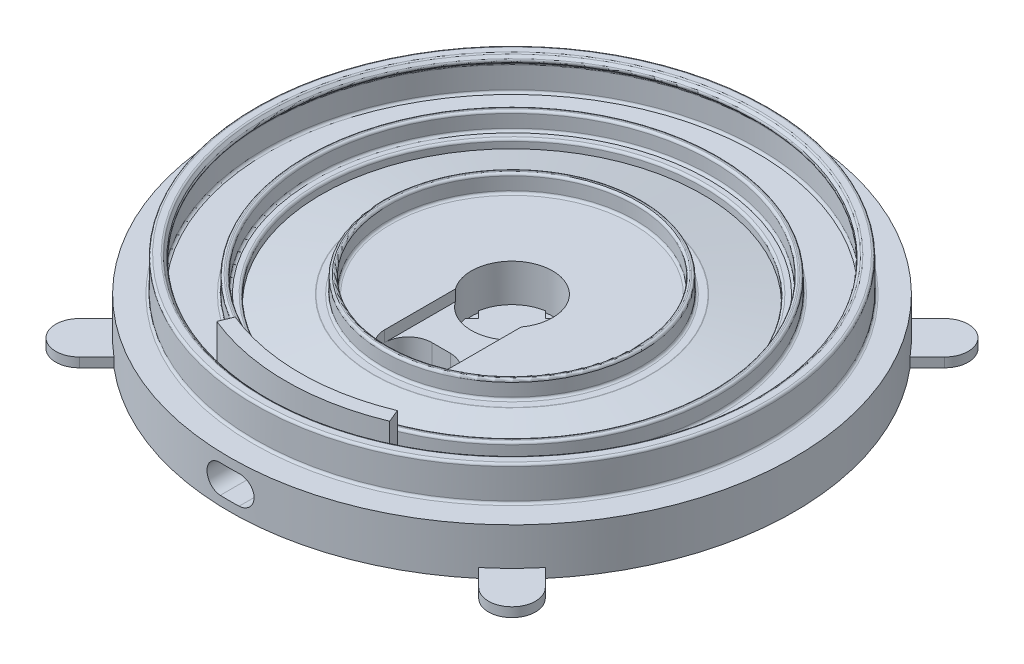
from build123d import *

# Parameters (mm, degrees)
SKETCH1_R               = 60
BOSS_EXTRUDE1_DEPTH     = 10
SKETCH3_R               = 43.75
SKETCH3_R_2             = 42.5
SKETCH3_R_3             = 27.5
SKETCH3_R_4             = 26.25
BOSS_EXTRUDE2_DEPTH     = 3.723
FILLET1_R               = 0.5
FILLET2_R               = 0.5
SKETCH6_R               = 8.625
CUT_EXTRUDE1_DEPTH      = 8.354
SKETCH9_W               = 14
SKETCH9_H               = 15
CUT_EXTRUDE2_DEPTH      = 2.354
CUT_EXTRUDE3_DEPTH      = 10
CUT_EXTRUDE4_DEPTH      = 2
CUT_EXTRUDE4_DEPTH_BACK = 40
BOSS_EXTRUDE3_DEPTH     = 2
BOSS_EXTRUDE4_DEPTH     = 8


with BuildPart() as part:
    # Sketch1 → Boss-Extrude1 (new body)
    with BuildSketch(Plane(origin=(0, 0, 0), x_dir=(1, 0, 0), z_dir=(0, 1, 0))):
        Circle(SKETCH1_R)
    extrude(amount=BOSS_EXTRUDE1_DEPTH)

    # Sketch2 → Cut-Revolve1 (revolve, cut)
    with BuildSketch(Plane.XY):
        Polygon((-29.5, 10), (-40.5, 8.127), (-40.5, 10), align=None)
    revolve(axis=Axis((0, 10, 0), (0, -1, 0)), mode=Mode.SUBTRACT)

    # Sketch3 → Boss-Extrude2 (add)
    # profile 1 of 2: a face of its own
    with BuildSketch(Plane(origin=(0, 10, 0), x_dir=(1, 0, 0), z_dir=(0, 1, 0))):
        Circle(SKETCH3_R)
        Circle(SKETCH3_R_2, mode=Mode.SUBTRACT)
    # profile 2 of 2: a face of its own
    with BuildSketch(Plane(origin=(0, 10, 0), x_dir=(1, 0, 0), z_dir=(0, 1, 0))):
        Circle(SKETCH3_R_3)
        Circle(SKETCH3_R_4, mode=Mode.SUBTRACT)
    extrude(amount=BOSS_EXTRUDE2_DEPTH)

    # Fillet1
    fillet1_edges = [part.edges().sort_by_distance(p)[0] for p in [
        (-26.25, 10, 0),
        (-27.5, 10, 0),
        (-43.75, 10, 0),
        (-42.5, 10, 0),
        (40.5, 10, 0),
        (-27.5, 13.723, 0),
        (-26.25, 13.723, 0),
        (-43.75, 13.723, 0),
        (-42.5, 13.723, 0),
        (29.5, 10, 0),
    ]]
    fillet(fillet1_edges, radius=FILLET1_R)

    # Sketch5 → Revolve1 (revolve)
    with BuildSketch(Plane.XY):
        Polygon((-52.5, 10), (-54.5, 10), (-54.5, 17.323), (-52.5, 17.323), (-51.5, 16.323), (-52.5, 15.323), align=None)
    revolve(axis=Axis((0, 10, 0), (0, 1, 0)))

    # Fillet2
    fillet2_edges = [part.edges().sort_by_distance(p)[0] for p in [
        (52.5, 10, 0),
        (52.5, 15.323, 0),
        (52.5, 17.323, 0),
        (51.5, 16.323, 0),
        (54.5, 10, 0),
        (54.5, 17.323, 0),
    ]]
    fillet(fillet2_edges, radius=FILLET2_R)

    # Sketch6 → Cut-Extrude1 (cut)
    with BuildSketch(Plane(origin=(0, 10, 0), x_dir=(1, 0, 0), z_dir=(0, 1, 0))):
        Circle(SKETCH6_R)
    extrude(amount=-CUT_EXTRUDE1_DEPTH, mode=Mode.SUBTRACT)

    # Sketch9 → Cut-Extrude2 (cut)
    with BuildSketch(Plane(origin=(0, 10, 0), x_dir=(1, 0, 0), z_dir=(0, 1, 0))):
        with Locations((0, -12.538911093)):
            Rectangle(SKETCH9_W, SKETCH9_H)
    extrude(amount=-CUT_EXTRUDE2_DEPTH, mode=Mode.SUBTRACT)

    # Sketch10 → Cut-Extrude3 (cut)
    with BuildSketch(Plane(origin=(0, 10, 0), x_dir=(1, 0, 0), z_dir=(0, 1, 0))):
        with BuildLine():
            Line((2, -25.038911093), (-2, -25.038911093))
            ThreePointArc((-2, -25.038911093), (-7, -20.038911093), (-2, -15.038911093))
            Line((-2, -15.038911093), (2, -15.038911093))
            ThreePointArc((2, -15.038911093), (7, -20.038911093), (2, -25.038911093))
        make_face()
    extrude(amount=-CUT_EXTRUDE3_DEPTH, mode=Mode.SUBTRACT)

    # Sketch11 → Cut-Extrude4 (cut, two sides: drawn at the far end of the back side and taken through both)
    with BuildSketch(Plane(origin=(0, 0, 25.038911093), x_dir=(-1, 0, 0), z_dir=(0, 0, -1)).offset(-CUT_EXTRUDE4_DEPTH_BACK)):
        with BuildLine():
            Line((-2, 8), (2, 8))
            ThreePointArc((2, 8), (5, 5), (2, 2))
            Line((2, 2), (-2, 2))
            ThreePointArc((-2, 2), (-5, 5), (-2, 8))
        make_face()
    extrude(amount=CUT_EXTRUDE4_DEPTH + CUT_EXTRUDE4_DEPTH_BACK, mode=Mode.SUBTRACT)

    # Sketch12 → Boss-Extrude3 (add)
    with BuildSketch(Plane.XZ):
        with BuildLine():
            Line((-49.497474683, -42.426406871), (42.426406871, 49.497474683))
            ThreePointArc((42.426406871, 49.497474683), (49.497474683, 49.497474683), (49.497474683, 42.426406871))
            Line((49.497474683, 42.426406871), (-42.426406871, -49.497474683))
            ThreePointArc((-42.426406871, -49.497474683), (-49.497474683, -49.497474683), (-49.497474683, -42.426406871))
        make_face()
        with BuildLine():
            Line((42.426406871, -49.497474683), (-49.497474683, 42.426406871))
            ThreePointArc((-49.497474683, 42.426406871), (-49.497474683, 49.497474683), (-42.426406871, 49.497474683))
            Line((-42.426406871, 49.497474683), (49.497474683, -42.426406871))
            ThreePointArc((49.497474683, -42.426406871), (49.497474683, -49.497474683), (42.426406871, -49.497474683))
        make_face()
    extrude(amount=-BOSS_EXTRUDE3_DEPTH)

    # Sketch13 → Boss-Extrude4 (add)
    with BuildSketch(Plane(origin=(0, 10, 0), x_dir=(1, 0, 0), z_dir=(0, 1, 0))):
        with BuildLine():
            Line((-18.368804754, -44.346217561), (-17.220754456, -41.574578963))
            ThreePointArc((-17.220754456, -41.574578963), (0, -45), (17.220754456, -41.574578963))
            Line((17.220754456, -41.574578963), (18.368804754, -44.346217561))
            ThreePointArc((18.368804754, -44.346217561), (0, -48), (-18.368804754, -44.346217561))
        make_face()
    extrude(amount=BOSS_EXTRUDE4_DEPTH)


solid = part.part
